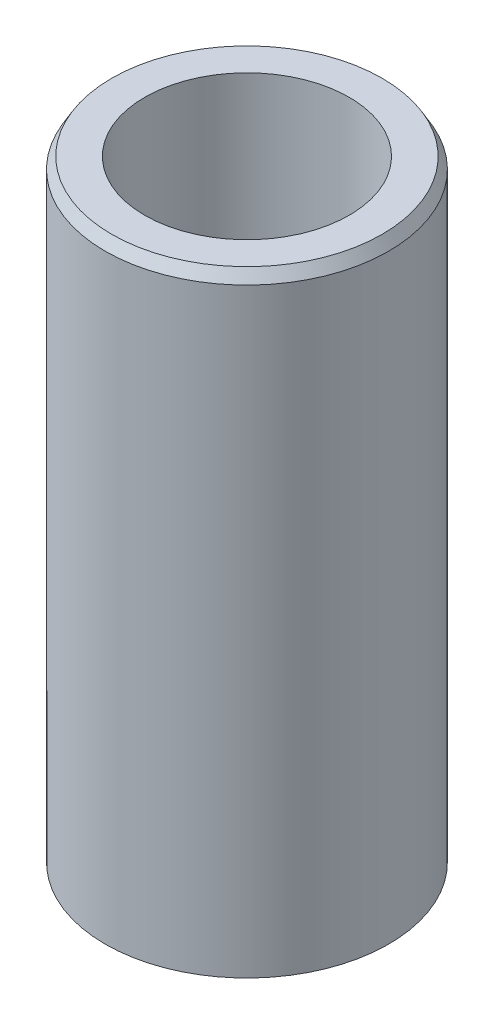
from build123d import *
from OCP.BRepFilletAPI import BRepFilletAPI_MakeChamfer

# Parameters (mm, degrees)
SKETCH1_R           = 57.5
BOSS_EXTRUDE1_DEPTH = 250.681840266
SKETCH2_R           = 41.476972348
CUT_EXTRUDE1_DEPTH  = 264.541050008
CHAMFER1_SIZE       = 4.59926416
CHAMFER1_SIZE2      = 2.655386401


with BuildPart() as part:
    # Sketch1 → Boss-Extrude1 (new body)
    with BuildSketch(Plane(origin=(0, 0, 0), x_dir=(1, 0, 0), z_dir=(0, 1, 0))):
        Circle(SKETCH1_R)
    extrude(amount=BOSS_EXTRUDE1_DEPTH)

    # Sketch2 → Cut-Extrude1 (cut, through all)
    with BuildSketch(Plane(origin=(0, 0, 0), x_dir=(1, 0, 0), z_dir=(0, 1, 0))):
        Circle(SKETCH2_R)
    extrude(amount=CUT_EXTRUDE1_DEPTH, mode=Mode.SUBTRACT)

    # Chamfer1: one chamfer whose edges measure the first distance from different faces: ONE call of the kernel's chamfer builder (chamfer() names one face for all edges)
    chamfer1_edges_1 = [part.edges().sort_by_distance(p)[0] for p in [
        (-57.5, 250.681840266, 0),
    ]]
    chamfer1_side_1 = [part.faces().sort_by_distance(p)[0] for p in [
        (-57.5, 125.340920133, 0),
    ]]
    chamfer1_edges_2 = [part.edges().sort_by_distance(p)[0] for p in [
        (-57.5, 0, 0),
    ]]
    chamfer1_side_2 = [part.faces().sort_by_distance(p)[0] for p in [
        (-55.873654403, 0, 0),
    ]]
    chamfer1 = BRepFilletAPI_MakeChamfer(part.part.solid().wrapped)
    for e in chamfer1_edges_1:
        chamfer1.Add(CHAMFER1_SIZE, CHAMFER1_SIZE2, e.wrapped, chamfer1_side_1[0].wrapped)  # the first distance lies on this face
    for e in chamfer1_edges_2:
        chamfer1.Add(CHAMFER1_SIZE, CHAMFER1_SIZE2, e.wrapped, chamfer1_side_2[0].wrapped)  # the first distance lies on this face
    add(Compound.cast(chamfer1.Shape()), mode=Mode.REPLACE)


solid = part.part
